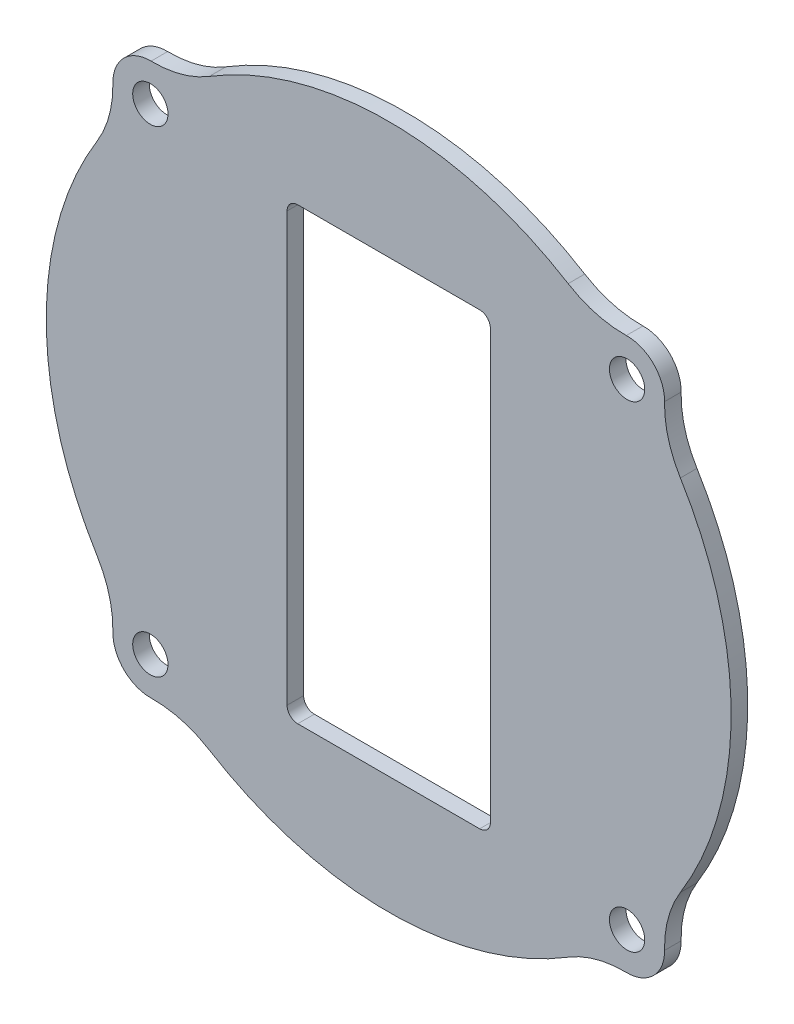
from build123d import *

# Parameters (mm, degrees)
ESQUISSE1_R             = 1.65
BOSS_EXTRU_1_DEPTH      = 1.55
ESQUISSE2_W             = 19
ESQUISSE2_H             = 42
ENL_V_MAT_EXTRU_1_DEPTH = 46.281370341
CONG_1_R                = 10
CONG_2_R                = 1


with BuildPart() as part:
    # Esquisse1 → Boss.-Extru.1 (new body)
    with BuildSketch(Plane.XY):
        with BuildLine():
            ThreePointArc((-24.957906965, 20.02755302), (-32, 0), (-24.957906965, -20.02755302))
            ThreePointArc((-24.957906965, -20.02755302), (-24.748737342, -24.748737342), (-20.02755302, -24.957906965))
            ThreePointArc((-20.02755302, -24.957906965), (0, -32), (20.02755302, -24.957906965))
            ThreePointArc((20.02755302, -24.957906965), (24.748737342, -24.748737342), (24.957906965, -20.02755302))
            ThreePointArc((24.957906965, -20.02755302), (32, 0), (24.957906965, 20.02755302))
            ThreePointArc((24.957906965, 20.02755302), (24.748737342, 24.748737342), (20.02755302, 24.957906965))
            ThreePointArc((20.02755302, 24.957906965), (0, 32), (-20.02755302, 24.957906965))
            ThreePointArc((-20.02755302, 24.957906965), (-24.748737342, 24.748737342), (-24.957906965, 20.02755302))
        make_face()
        with Locations((-22.273863607, 22.273863607)):
            Circle(ESQUISSE1_R, mode=Mode.SUBTRACT)
        with Locations((22.273863607, 22.273863607)):
            Circle(ESQUISSE1_R, mode=Mode.SUBTRACT)
        with Locations((22.273863607, -22.273863607)):
            Circle(ESQUISSE1_R, mode=Mode.SUBTRACT)
        with Locations((-22.273863607, -22.273863607)):
            Circle(ESQUISSE1_R, mode=Mode.SUBTRACT)
    extrude(amount=BOSS_EXTRU_1_DEPTH)

    # Esquisse2 → Enlèv. mat.-Extru.1 (cut, through all)
    with BuildSketch(Plane.XY.offset(1.55)):
        Rectangle(ESQUISSE2_W, ESQUISSE2_H)
    extrude(amount=-ENL_V_MAT_EXTRU_1_DEPTH, mode=Mode.SUBTRACT)

    # Congé1
    cong_1_edges = [part.edges().sort_by_distance(p)[0] for p in [
        (24.957906965, -20.02755302, 0.775),
        (20.02755302, -24.957906965, 0.775),
        (-20.02755302, -24.957906965, 0.775),
        (-24.957906965, -20.02755302, 0.775),
        (-24.957906965, 20.02755302, 0.775),
        (-20.02755302, 24.957906965, 0.775),
        (20.02755302, 24.957906965, 0.775),
        (24.957906965, 20.02755302, 0.775),
    ]]
    fillet(cong_1_edges, radius=CONG_1_R)

    # Congé2
    cong_2_edges = [part.edges().sort_by_distance(p)[0] for p in [
        (9.5, 21, 0.775),
        (9.5, -21, 0.775),
        (-9.5, -21, 0.775),
        (-9.5, 21, 0.775),
    ]]
    fillet(cong_2_edges, radius=CONG_2_R)


solid = part.part
